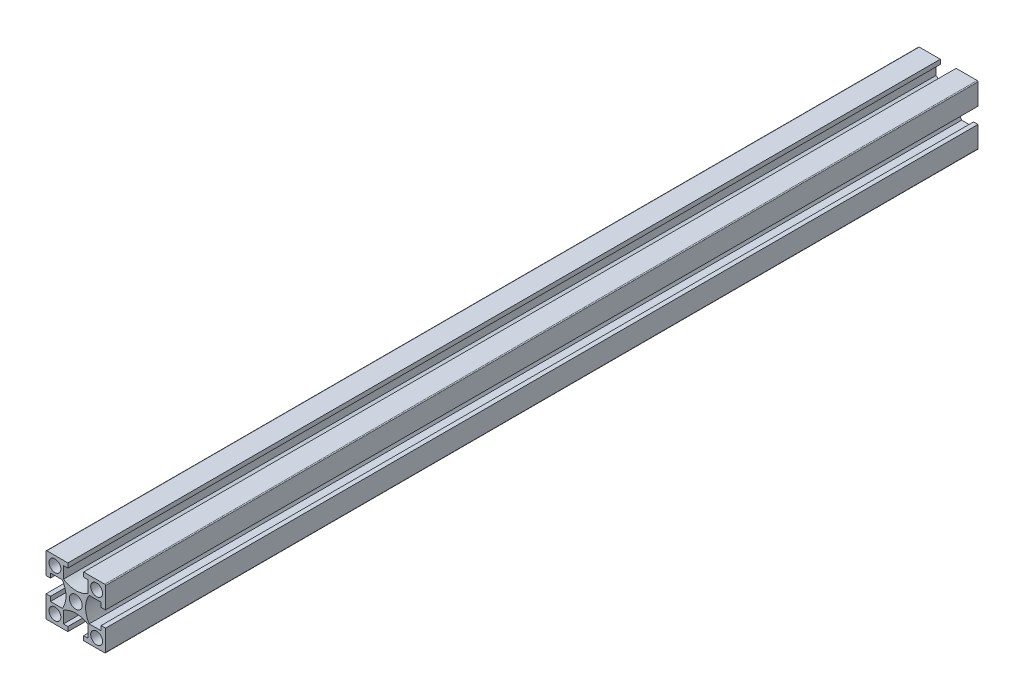
from build123d import *

# Parameters (mm, degrees)
SKETCH_1_W               = 20
SKETCH_1_H               = 20
SKETCH_1_R               = 2
SKETCH_1_R_2             = 2.15
EXTRUDE_1_DEPTH          = 293
CUT_EXTRUDE_1_REACH      = 295.341
PATTERN_CIRCULAR_1_COUNT = 4
FILLET_1_R               = 0.3
CUT_EXTRUDE_2_DEPTH      = 294.341098382
CUT_EXTRUDE_2_DEPTH_BACK = 294.341098382
SKETCH_2_R               = 2.5


with BuildPart() as part:
    # 스케치1 → 보스-돌출1 (new body)
    with BuildSketch(Plane.XY):
        Rectangle(SKETCH_1_W, SKETCH_1_H)
        with Locations((-7, -7)):
            Circle(SKETCH_1_R, mode=Mode.SUBTRACT)
        with Locations((7, -7)):
            Circle(SKETCH_1_R, mode=Mode.SUBTRACT)
        with Locations((-7, 7)):
            Circle(SKETCH_1_R, mode=Mode.SUBTRACT)
        Circle(SKETCH_1_R_2, mode=Mode.SUBTRACT)
        with Locations((7, 7)):
            Circle(SKETCH_1_R, mode=Mode.SUBTRACT)
    extrude(amount=EXTRUDE_1_DEPTH)

    # 스케치1<3> → 컷-돌출1 (cut, up to next)
    with BuildSketch(Plane.XY, mode=Mode.PRIVATE) as cut_extrude_1_sk1:
        with BuildLine():
            Line((-8.5, 2.65), (-10, 2.65))
            Line((-10, 2.65), (-10, -2.65))
            Line((-10, -2.65), (-8.5, -2.65))
            Line((-8.5, -2.65), (-8.5, -4.15))
            Line((-8.5, -4.15), (-4.503166667, -4.15))
            ThreePointArc((-4.503166667, -4.15), (-3.3, 0), (-4.503166667, 4.15))
            Line((-4.503166667, 4.15), (-8.5, 4.15))
            Line((-8.5, 4.15), (-8.5, 2.65))
        make_face()
    cut_extrude_1_tool1 = extrude(cut_extrude_1_sk1.sketch, amount=CUT_EXTRUDE_1_REACH, mode=Mode.PRIVATE) & part.part
    cut_extrude_1 = cut_extrude_1_tool1.solids().sort_by_distance((-6.606913, 0, 0))[0]
    add(cut_extrude_1, mode=Mode.SUBTRACT)

    # 원형 패턴1: 컷-돌출1 ×4 about axis
    pattern_circular_1_axis = Axis((0, 0, 293), (0, 0, -1))
    for i in range(1, PATTERN_CIRCULAR_1_COUNT):
        add(cut_extrude_1.rotate(pattern_circular_1_axis, i * 360 / PATTERN_CIRCULAR_1_COUNT), mode=Mode.SUBTRACT)

    # 필렛1
    fillet_1_edges = [part.edges().sort_by_distance(p)[0] for p in [
        (10, -10, 146.5),
        (-10, -10, 146.5),
        (-10, 10, 146.5),
        (10, 10, 146.5),
    ]]
    fillet(fillet_1_edges, radius=FILLET_1_R)

    # 스케치2 → 컷-돌출2 (cut, two sides: drawn at the far end of the back side and taken through both)
    with BuildSketch(Plane(origin=(0, 0, 0), x_dir=(0, 0, -1), z_dir=(1, 0, 0)).offset(-CUT_EXTRUDE_2_DEPTH_BACK)):
        with Locations((-25, 0)):
            Circle(SKETCH_2_R)
    extrude(amount=CUT_EXTRUDE_2_DEPTH + CUT_EXTRUDE_2_DEPTH_BACK, mode=Mode.SUBTRACT)


solid = part.part
